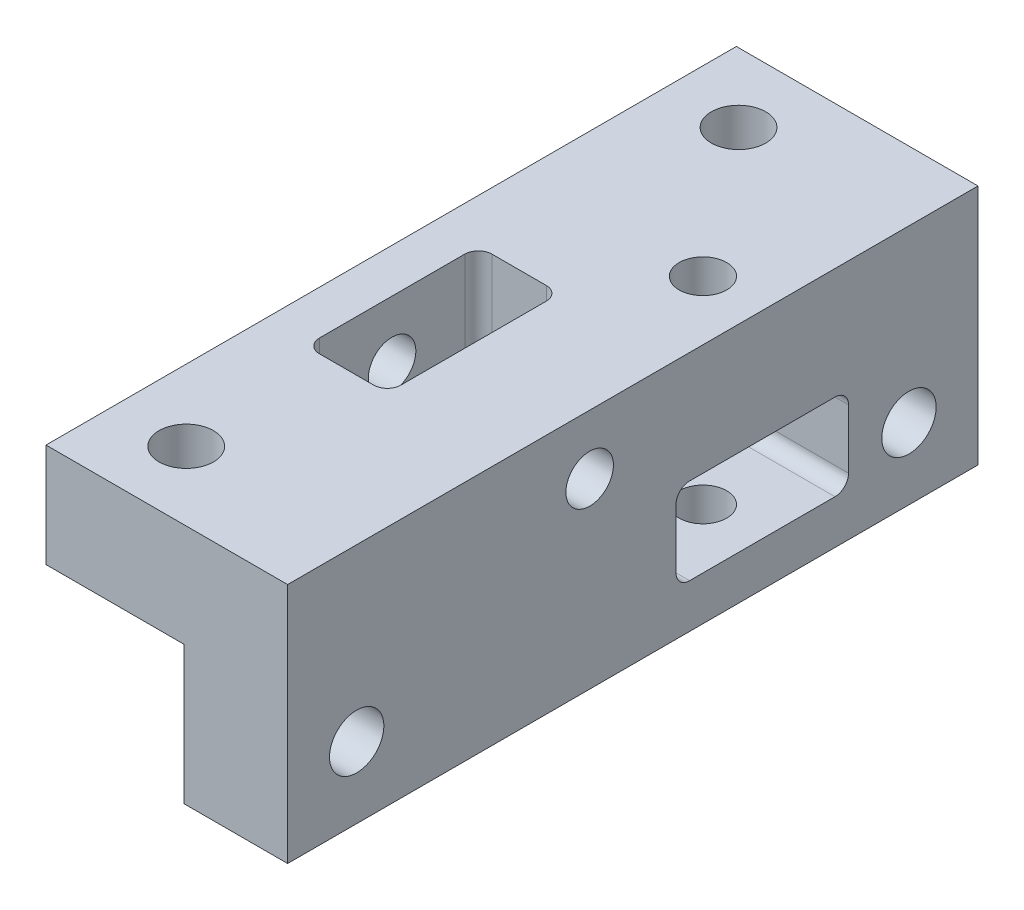
from build123d import *

# Parameters (mm, degrees)
BOSS_EXTRUDE2_DEPTH = 50.8
SKETCH3_R           = 1.75
CUT_EXTRUDE1_DEPTH  = 76.2
SKETCH4_R           = 2
SKETCH4_W           = 6.35
SKETCH4_H           = 12.7
CUT_EXTRUDE2_DEPTH  = 76.2
SKETCH6_R           = 1.75
CUT_EXTRUDE3_DEPTH  = 76.2
SKETCH7_R           = 2
SKETCH7_W           = 6
SKETCH7_H           = 12.7
CUT_EXTRUDE4_DEPTH  = 76.2
FILLET1_R           = 1


with BuildPart() as part:
    # Sketch2 → Boss-Extrude2 (new body)
    with BuildSketch(Plane(origin=(0, 0, 0), x_dir=(0, 1, 0), z_dir=(0, 0, 1))):
        Polygon((0, 0), (-17.78, 0), (-17.78, 7.62), (-7.62, 7.62), (-7.62, 17.78), (0, 17.78), align=None)
    extrude(amount=BOSS_EXTRUDE2_DEPTH)

    # Sketch3 → Cut-Extrude1 (cut)
    with BuildSketch(Plane(origin=(0, 0, 0), x_dir=(-1, 0, 0), z_dir=(0, 1, 0))):
        with Locations((4.36625, 15.875)):
            Circle(SKETCH3_R)
    extrude(amount=-CUT_EXTRUDE1_DEPTH, mode=Mode.SUBTRACT)

    # Sketch4 → Cut-Extrude2 (cut)
    with BuildSketch(Plane(origin=(-7.62, 0, 0), x_dir=(0, -1, 0), z_dir=(-1, 0, 0))):
        with Locations((12.54125, 5.08)):
            Circle(SKETCH4_R)
        with Locations((12.54125, 45.72)):
            Circle(SKETCH4_R)
        with Locations((11.366242, 15.875)):
            Rectangle(SKETCH4_W, SKETCH4_H)
    extrude(amount=-CUT_EXTRUDE2_DEPTH, mode=Mode.SUBTRACT)

    # Sketch6 → Cut-Extrude3 (cut)
    with BuildSketch(Plane(origin=(-17.78, 0, 0), x_dir=(0, -1, 0), z_dir=(-1, 0, 0))):
        with Locations((4.36626, 28.575)):
            Circle(SKETCH6_R)
    extrude(amount=-CUT_EXTRUDE3_DEPTH, mode=Mode.SUBTRACT)

    # Sketch7 → Cut-Extrude4 (cut)
    with BuildSketch(Plane.XZ.offset(7.62)):
        with Locations((-12.54125, 45.72)):
            Circle(SKETCH7_R)
        with Locations((-12.54125, 5.08)):
            Circle(SKETCH7_R)
        with Locations((-11.541246, 28.575)):
            Rectangle(SKETCH7_W, SKETCH7_H)
    extrude(amount=-CUT_EXTRUDE4_DEPTH, mode=Mode.SUBTRACT)

    # Fillet1
    fillet1_edges = [part.edges().sort_by_distance(p)[0] for p in [
        (-3.81, -14.541242, 9.525),
        (-3.81, -14.541242, 22.225),
        (-3.81, -8.191242, 22.225),
        (-3.81, -8.191242, 9.525),
        (-8.541246, -3.81, 22.225),
        (-14.541246, -3.81, 22.225),
        (-8.541246, -3.81, 34.925),
        (-14.541246, -3.81, 34.925),
    ]]
    fillet(fillet1_edges, radius=FILLET1_R)


solid = part.part
